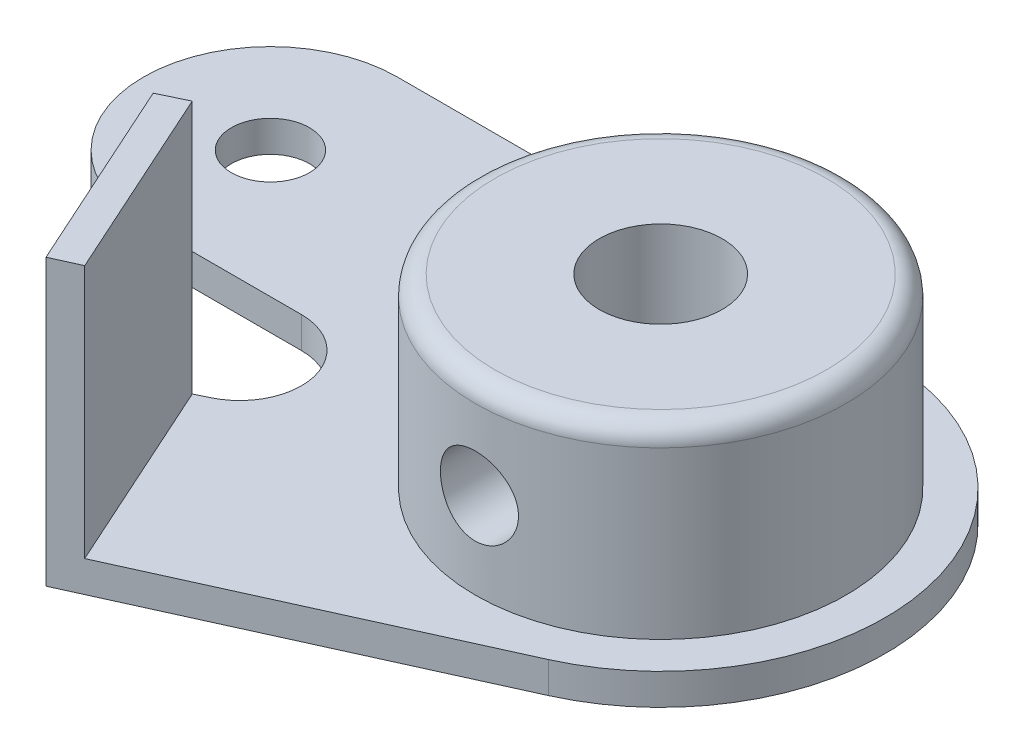
from build123d import *

# Parameters (mm, degrees)
ESQUISSE1_R             = 3.15
ESQUISSE1_R_2           = 2
BOSS_EXTRU_1_DEPTH      = 1.6
ESQUISSE2_R             = 9.5
ESQUISSE2_R_2           = 3.15
BOSS_EXTRU_2_DEPTH      = 9.5
CONG_1_R                = 1
BOSS_EXTRU_3_DEPTH      = 13
ESQUISSE4_R             = 2
ENL_V_MAT_EXTRU_1_DEPTH = 40.340310116


with BuildPart() as part:
    # Esquisse1 → Boss.-Extru.1 (new body)
    with BuildSketch(Plane(origin=(0, 0, 0), x_dir=(1, 0, 0), z_dir=(0, 1, 0))):
        with BuildLine():
            Line((0, 11.5), (-25, 11.5))
            ThreePointArc((-25, 11.5), (-31.5, 5), (-25, -1.5))
            Line((-25, -1.5), (-16.90921754, -1.5))
            ThreePointArc((-16.90921754, -1.5), (-13.826301978, -3.956560509), (-15.532463951, -7.510159982))
            Line((-15.532463951, -7.510159982), (-17.532463951, -8.477187494))
            Line((-17.532463951, -8.477187494), (-13, -18.5))
            Line((-13, -18.5), (4.73848504, -10.478394893))
            ThreePointArc((4.73848504, -10.478394893), (11.241697854, 2.423680954), (0, 11.5))
        make_face()
        Circle(ESQUISSE1_R, mode=Mode.SUBTRACT)
        with Locations((-25, 5)):
            Circle(ESQUISSE1_R_2, mode=Mode.SUBTRACT)
    extrude(amount=BOSS_EXTRU_1_DEPTH)

    # Esquisse2 → Boss.-Extru.2 (add)
    with BuildSketch(Plane(origin=(0, 1.6, 0), x_dir=(1, 0, 0), z_dir=(0, 1, 0))):
        Circle(ESQUISSE2_R)
        Circle(ESQUISSE2_R_2, mode=Mode.SUBTRACT)
    extrude(amount=BOSS_EXTRU_2_DEPTH)

    # Congé1
    cong_1_edges = [part.edges().sort_by_distance(p)[0] for p in [
        (-9.5, 11.1, 0),
    ]]
    fillet(cong_1_edges, radius=CONG_1_R)

    # Esquisse3 → Boss.-Extru.3 (add)
    with BuildSketch(Plane(origin=(0, 1.6, 0), x_dir=(1, 0, 0), z_dir=(0, 1, 0))):
        Polygon((-17.532463951, -8.477187494), (-13, -18.5), (-11.633703391, -17.88214048), (-16.182035998, -7.824237002), align=None)
    extrude(amount=BOSS_EXTRU_3_DEPTH)

    # Esquisse4 → Enlèv. mat.-Extru.1 (cut, through all)
    with BuildSketch(Plane.XY):
        with Locations((0, 6)):
            Circle(ESQUISSE4_R)
    extrude(amount=ENL_V_MAT_EXTRU_1_DEPTH, mode=Mode.SUBTRACT)


solid = part.part
